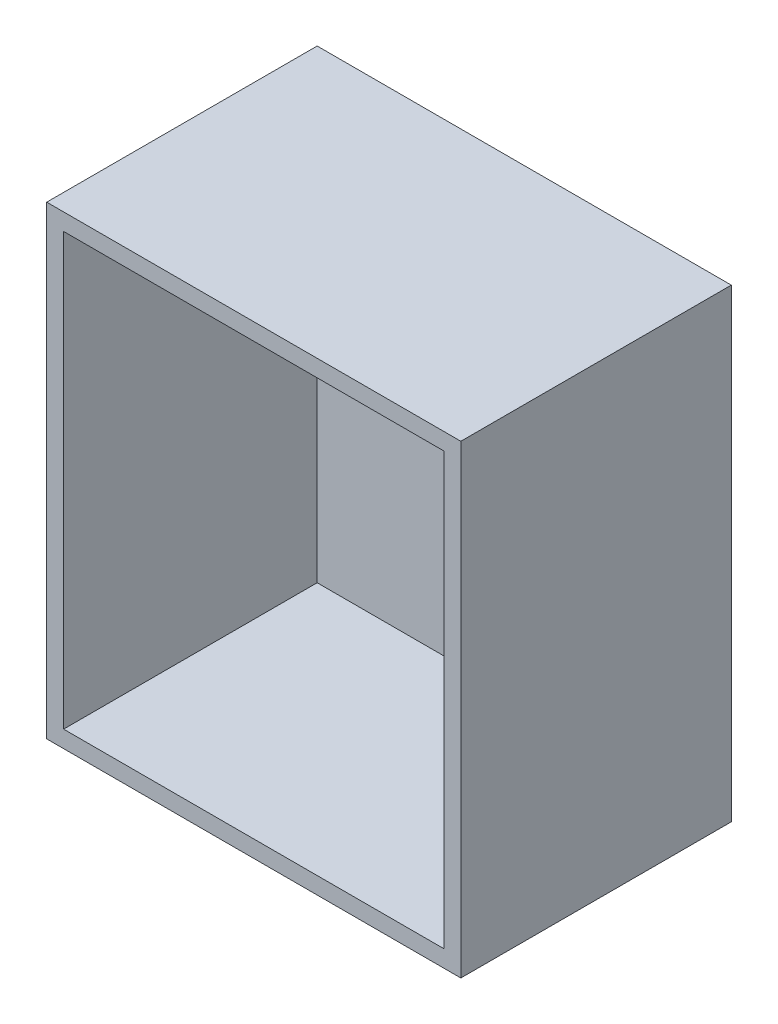
from build123d import *

# Parameters (mm, degrees)
SCHIZZO1_W                   = 49
SCHIZZO1_H                   = 55
ESTRUSIONE_ESTRUSIONE1_DEPTH = 2
SCHIZZO3_W                   = 49
SCHIZZO3_H                   = 2
ESTRUSIONE_ESTRUSIONE2_DEPTH = 30
SCHIZZO4_W                   = 2
SCHIZZO4_H                   = 53
ESTRUSIONE_ESTRUSIONE3_DEPTH = 30
SCHIZZO5_W                   = 47
SCHIZZO5_H                   = 2
ESTRUSIONE_ESTRUSIONE4_DEPTH = 30
SCHIZZO6_W                   = 2
SCHIZZO6_H                   = 51
ESTRUSIONE_ESTRUSIONE5_DEPTH = 30
SCHIZZO7_W                   = 26
SCHIZZO7_H                   = 3
ESTRUSIONE_ESTRUSIONE6_DEPTH = 13
SCHIZZO9_W                   = 3.5
SCHIZZO9_H                   = 51
ESTRUSIONE_ESTRUSIONE7_DEPTH = 13
SCHIZZO10_W                  = 4
SCHIZZO10_H                  = 1.5
TAGLIO_ESTRUSIONE1_DEPTH     = 6
SCHIZZO11_W                  = 1.5
SCHIZZO11_H                  = 1.5
TAGLIO_ESTRUSIONE2_DEPTH     = 6
SCHIZZO12_W                  = 4
SCHIZZO12_H                  = 1
TAGLIO_ESTRUSIONE3_DEPTH     = 0.75
SCHIZZO13_W                  = 4
SCHIZZO13_H                  = 1
TAGLIO_ESTRUSIONE4_DEPTH     = 0.75
SCHIZZO14_W                  = 4
SCHIZZO14_H                  = 1
TAGLIO_ESTRUSIONE5_DEPTH     = 0.75
SCHIZZO15_W                  = 4
SCHIZZO15_H                  = 1
TAGLIO_ESTRUSIONE6_DEPTH     = 0.75
SCHIZZO21_W                  = 1
SCHIZZO21_H                  = 1.5
TAGLIO_ESTRUSIONE7_DEPTH     = 1
SCHIZZO23_W                  = 2.5
SCHIZZO23_H                  = 0.75
TAGLIO_ESTRUSIONE8_DEPTH     = 1
SCHIZZO24_W                  = 2.496840505
SCHIZZO24_H                  = 0.75
TAGLIO_ESTRUSIONE9_DEPTH     = 1
SCHIZZO26_W                  = 1.003159495
SCHIZZO26_H                  = 3
TAGLIO_ESTRUSIONE10_DEPTH    = 1


with BuildPart() as part:
    # Schizzo1 → Estrusione-Estrusione1 (new body)
    with BuildSketch(Plane.XY):
        with Locations((24.5, 27.5)):
            Rectangle(SCHIZZO1_W, SCHIZZO1_H)
    extrude(amount=ESTRUSIONE_ESTRUSIONE1_DEPTH)

    # Schizzo3 → Estrusione-Estrusione2 (add)
    with BuildSketch(Plane.XY.offset(2)):
        with Locations((24.5, 54)):
            Rectangle(SCHIZZO3_W, SCHIZZO3_H)
    extrude(amount=ESTRUSIONE_ESTRUSIONE2_DEPTH)

    # Schizzo4 → Estrusione-Estrusione3 (add)
    with BuildSketch(Plane.XY.offset(2)):
        with Locations((48, 26.5)):
            Rectangle(SCHIZZO4_W, SCHIZZO4_H)
    extrude(amount=ESTRUSIONE_ESTRUSIONE3_DEPTH)

    # Schizzo5 → Estrusione-Estrusione4 (add)
    with BuildSketch(Plane.XY.offset(2)):
        with Locations((23.5, 1)):
            Rectangle(SCHIZZO5_W, SCHIZZO5_H)
    extrude(amount=ESTRUSIONE_ESTRUSIONE4_DEPTH)

    # Schizzo6 → Estrusione-Estrusione5 (add)
    with BuildSketch(Plane.XY.offset(2)):
        with Locations((1, 27.5)):
            Rectangle(SCHIZZO6_W, SCHIZZO6_H)
    extrude(amount=ESTRUSIONE_ESTRUSIONE5_DEPTH)

    # Schizzo7 → Estrusione-Estrusione6 (add)
    with BuildSketch(Plane.XY.offset(2)):
        with Locations((15, 45.2)):
            Rectangle(SCHIZZO7_W, SCHIZZO7_H)
    extrude(amount=ESTRUSIONE_ESTRUSIONE6_DEPTH)

    # Schizzo9 → Estrusione-Estrusione7 (add)
    with BuildSketch(Plane.XY.offset(2)):
        with Locations((45.25, 27.5)):
            Rectangle(SCHIZZO9_W, SCHIZZO9_H)
    extrude(amount=ESTRUSIONE_ESTRUSIONE7_DEPTH)

    # Schizzo10 → Taglio-Estrusione1 (cut)
    with BuildSketch(Plane.XY.offset(15)):
        with Locations((6, 45.2)):
            Rectangle(SCHIZZO10_W, SCHIZZO10_H)
        with Locations((24, 45.2)):
            Rectangle(SCHIZZO10_W, SCHIZZO10_H)
    extrude(amount=-TAGLIO_ESTRUSIONE1_DEPTH, mode=Mode.SUBTRACT)

    # Schizzo11 → Taglio-Estrusione2 (cut)
    with BuildSketch(Plane.XY.offset(15)):
        with Locations((45.25, 45.2)):
            Rectangle(SCHIZZO11_W, SCHIZZO11_H)
    extrude(amount=-TAGLIO_ESTRUSIONE2_DEPTH, mode=Mode.SUBTRACT)

    # Schizzo12 → Taglio-Estrusione3 (cut)
    with BuildSketch(Plane(origin=(0, 45.95, 0), x_dir=(-1, 0, 0), z_dir=(0, -1, 0))):
        with Locations((-6, -14.5)):
            Rectangle(SCHIZZO12_W, SCHIZZO12_H)
    extrude(amount=-TAGLIO_ESTRUSIONE3_DEPTH, mode=Mode.SUBTRACT)

    # Schizzo13 → Taglio-Estrusione4 (cut)
    with BuildSketch(Plane(origin=(0, 44.45, 0), x_dir=(1, 0, 0), z_dir=(0, 1, 0))):
        with Locations((6, -14.5)):
            Rectangle(SCHIZZO13_W, SCHIZZO13_H)
    extrude(amount=-TAGLIO_ESTRUSIONE4_DEPTH, mode=Mode.SUBTRACT)

    # Schizzo14 → Taglio-Estrusione5 (cut)
    with BuildSketch(Plane(origin=(0, 45.95, 0), x_dir=(-1, 0, 0), z_dir=(0, -1, 0))):
        with Locations((-24, -14.5)):
            Rectangle(SCHIZZO14_W, SCHIZZO14_H)
    extrude(amount=-TAGLIO_ESTRUSIONE5_DEPTH, mode=Mode.SUBTRACT)

    # Schizzo15 → Taglio-Estrusione6 (cut)
    with BuildSketch(Plane(origin=(0, 44.45, 0), x_dir=(1, 0, 0), z_dir=(0, 1, 0))):
        with Locations((24, -14.5)):
            Rectangle(SCHIZZO15_W, SCHIZZO15_H)
    extrude(amount=-TAGLIO_ESTRUSIONE6_DEPTH, mode=Mode.SUBTRACT)

    # Schizzo21 → Taglio-Estrusione7 (cut)
    with BuildSketch(Plane.XY.offset(15)):
        with Locations((44, 45.2)):
            Rectangle(SCHIZZO21_W, SCHIZZO21_H)
    extrude(amount=-TAGLIO_ESTRUSIONE7_DEPTH, mode=Mode.SUBTRACT)

    # Schizzo23 → Taglio-Estrusione8 (cut)
    with BuildSketch(Plane.XY.offset(15)):
        with Locations((44.75, 46.325)):
            Rectangle(SCHIZZO23_W, SCHIZZO23_H)
    extrude(amount=-TAGLIO_ESTRUSIONE8_DEPTH, mode=Mode.SUBTRACT)

    # Schizzo24 → Taglio-Estrusione9 (cut)
    with BuildSketch(Plane.XY.offset(15)):
        with Locations((44.748420252, 44.075)):
            Rectangle(SCHIZZO24_W, SCHIZZO24_H)
    extrude(amount=-TAGLIO_ESTRUSIONE9_DEPTH, mode=Mode.SUBTRACT)

    # Schizzo26 → Taglio-Estrusione10 (cut)
    with BuildSketch(Plane.XY.offset(15)):
        with Locations((46.498420252, 45.2)):
            Rectangle(SCHIZZO26_W, SCHIZZO26_H)
    extrude(amount=-TAGLIO_ESTRUSIONE10_DEPTH, mode=Mode.SUBTRACT)


solid = part.part
